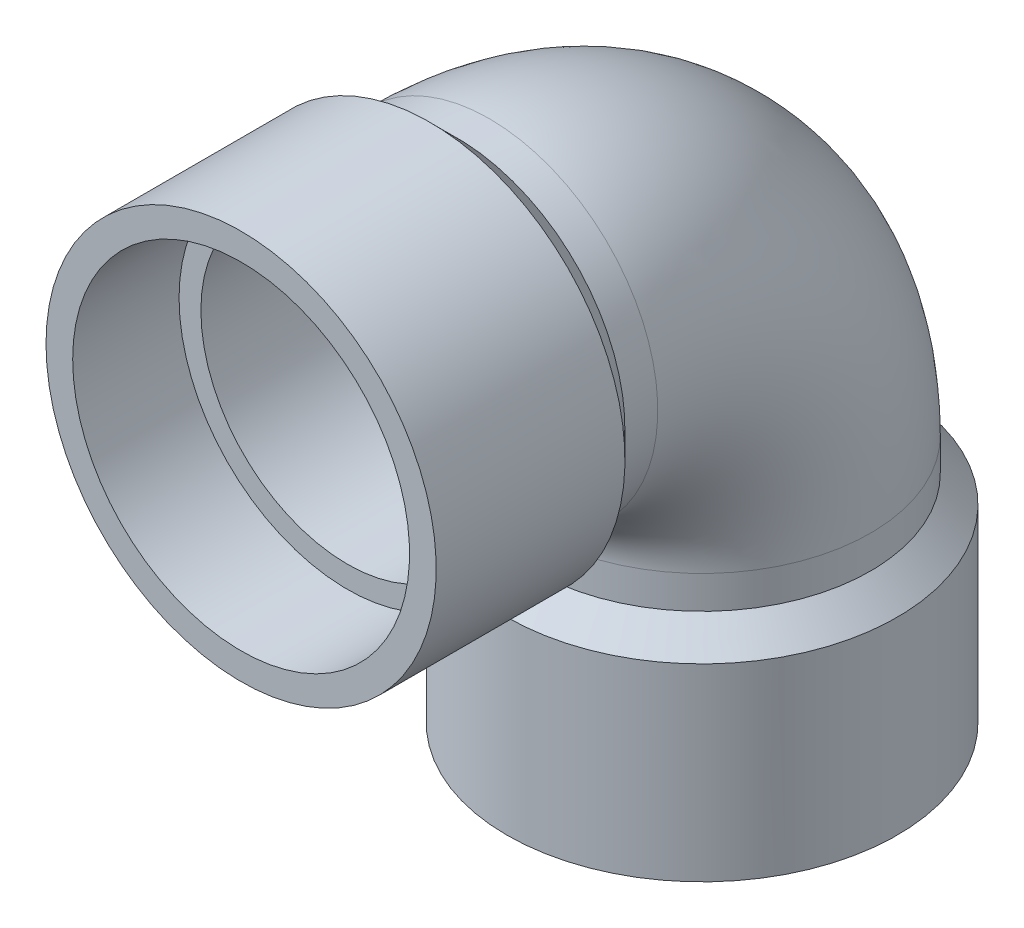
from build123d import *

# Parameters (mm, degrees)
SKETCH2_R           = 30.1625
SKETCH2_R_2         = 26.2509
BOSS_EXTRUDE1_START = -9.525
SKETCH9_R           = 34.9377
SKETCH9_R_2         = 30.1625
BOSS_EXTRUDE1_DEPTH = 28.575
CHAMFER1_SIZE       = 10


with BuildPart() as part:
    # Sweep2: sweep along a path in Sketch1
    with BuildLine(Plane(origin=(0, 0, 0), x_dir=(0, 0, -1), z_dir=(1, 0, 0))) as sweep2_path:
        Line((-63.5, 0), (-38.1, 0))
        ThreePointArc((-38.1, 0), (-11.159231637, -11.159231637), (0, -38.1))
        Line((0, -38.1), (0, -63.5))
    # Sketch2 → Sweep2 (sweep)
    with BuildSketch(Plane.XY.offset(63.5)):
        Circle(SKETCH2_R)
        Circle(SKETCH2_R_2, mode=Mode.SUBTRACT)
    sweep(path=sweep2_path.line)

    # Sketch9 → Boss-Extrude1 (add)
    with BuildSketch(Plane.XY.offset(63.5).offset(BOSS_EXTRUDE1_START)):
        with Locations(Location((0, 0, 0), (0, 0, 180))):
            Circle(SKETCH9_R)
        Circle(SKETCH9_R_2, mode=Mode.SUBTRACT)
    boss_extrude1 = extrude(amount=BOSS_EXTRUDE1_DEPTH)

    # Mirror4: Boss-Extrude1 across plane
    add(boss_extrude1.mirror(Plane(origin=(0, 0, 0), x_dir=(0, -0.7071067811865465, 0.7071067811865486), z_dir=(0, 0.7071067811865488, 0.7071067811865464))))

    # Chamfer1
    # the kernel refuses this chamfer: 10 mm, written as the material it adds along each edge
    with BuildSketch(Plane(origin=(0, 0, 53.975), x_dir=(1, 0, 0), z_dir=(0, -1, 0))) as chamfer1_piece_1_section:
        Polygon((30.1625, -CHAMFER1_SIZE), (30.1625 + CHAMFER1_SIZE, 0), (30.1625, 0), align=None)
    chamfer1_piece_1 = revolve(axis=Axis((0, 0, 53.975), (0, 0, 1)), mode=Mode.PRIVATE)
    chamfer1_piece_1 = chamfer1_piece_1 & Plane(origin=(0, 0, 46.362739963), x_dir=(-1, 0, 0), z_dir=(0, 0, -1)) * Cylinder(34.9377, 161, mode=Mode.PRIVATE)
    add(chamfer1_piece_1)
    with BuildSketch(Plane(origin=(0, -53.975, 0), x_dir=(1, 0, 0), z_dir=(0, 0, 1))) as chamfer1_piece_2_section:
        Polygon((30.1625, CHAMFER1_SIZE), (30.1625 + CHAMFER1_SIZE, 0), (30.1625, 0), align=None)
    chamfer1_piece_2 = revolve(axis=Axis((0, -53.975, 0), (0, 1, 0)), mode=Mode.PRIVATE)
    chamfer1_piece_2 = chamfer1_piece_2 & Plane(origin=(0, -46.362739963, 0), x_dir=(-1, 0, 0), z_dir=(0, 1, 0)) * Cylinder(34.9377, 161, mode=Mode.PRIVATE)
    add(chamfer1_piece_2)


solid = part.part
